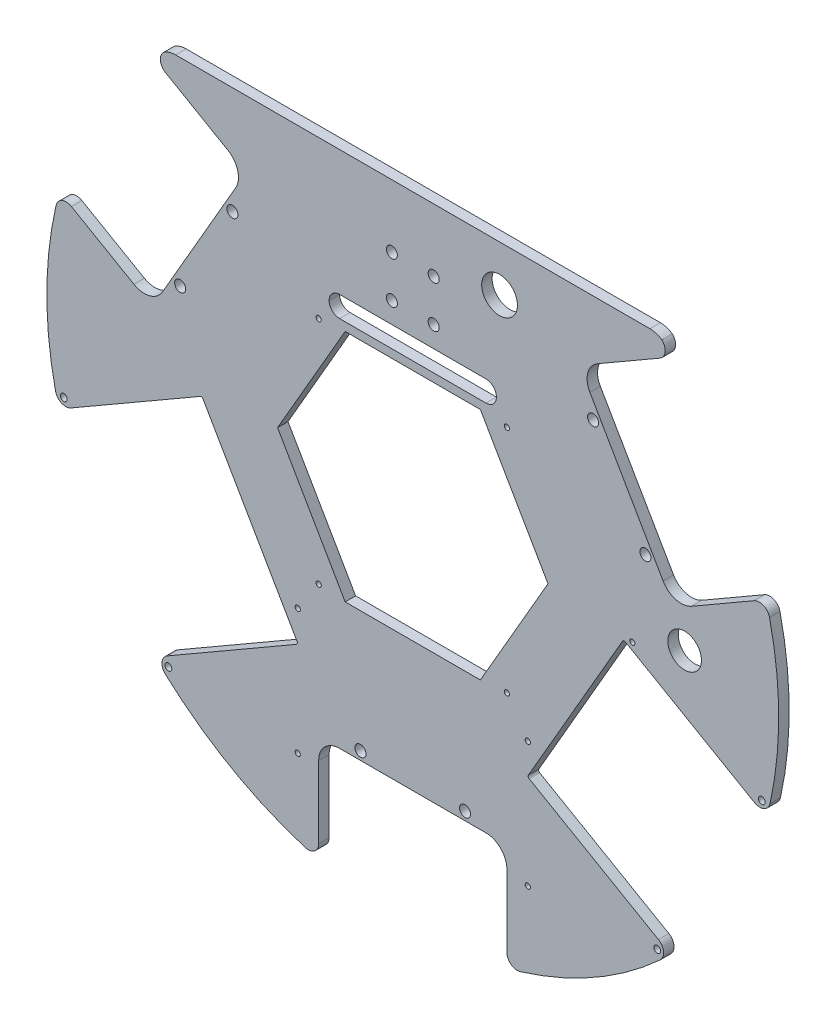
from build123d import *

# Parameters (mm, degrees)
SKETCH_1_R                   = 175
EXTRUDE_1_DEPTH              = 5
CUT_EXTRUDE_1_DEPTH          = 248.53787589
CUT_EXTRUDE_2_DEPTH          = 248.53787589
CUT_EXTRUDE_5_DEPTH          = 248.53787589
CUT_EXTRUDE_4_DEPTH          = 248.53787589
HOLE_WIZARD_M5_1_D           = 5.3
FILLET_1_R                   = 1
FILLET_2_R                   = 10
FILLET_3_R                   = 5
PATTERN_CIRCULAR_1_OUTLINE_R = 2.65
PATTERN_CIRCULAR_1_DEPTH     = 5
HOLE_WIZARD_M5_2_D           = 5.3
SKETCH_15_R                  = 8.55
CUT_EXTRUDE_3_DEPTH          = 243.280431899
MIRROR_1_DEPTH               = 5
SKETCH_18_W                  = 80
SKETCH_18_H                  = 10
CUT_EXTRUDE_6_DEPTH          = 243.280431899
FILLET_4_R                   = 5
M4X0_7_3_D                   = 3.3
SKETCH_33_R                  = 8.05
CUT_EXTRUDE_7_DEPTH          = 243.280431899
M3X0_5_2_D                   = 2.5
M3X0_5_3_D                   = 2.5
FILLET_5_R                   = 10


with BuildPart() as part:
    # 草圖1 → 填料-伸長1 (new body)
    with BuildSketch(Plane.XY):
        Circle(SKETCH_1_R)
    extrude(amount=EXTRUDE_1_DEPTH)

    # 草圖6 → 除料-伸長1 (cut, through all)
    with BuildSketch(Plane.XY.offset(5)):
        with BuildLine():
            Line((-45, -169.115345253), (-45, -118))
            Line((-45, -118), (45, -118))
            Line((45, -118), (45, -169.115345253))
            ThreePointArc((45, -169.115345253), (0, -175), (-45, -169.115345253))
        make_face()
    extrude(amount=-CUT_EXTRUDE_1_DEPTH, mode=Mode.SUBTRACT)

    # 草圖11 → 除料-伸長2 (cut, through all)
    with BuildSketch(Plane.XY.offset(5)):
        Polygon((64.663230149, 0), (32.331615075, 56), (-32.331615075, 56), (-64.663230149, 0), (-32.331615075, -56), (32.331615075, -56), align=None)
    extrude(amount=-CUT_EXTRUDE_2_DEPTH, mode=Mode.SUBTRACT)

    # 草圖17 → 除料-伸長5 (cut, through all)
    with BuildSketch(Plane.XY.offset(5)):
        with BuildLine():
            Line((-169.224997863, -44.585873304), (-100.808990964, -5.085873304))
            Line((-100.808990964, -5.085873304), (-54.808990964, -84.760210452))
            Line((-54.808990964, -84.760210452), (-123.224997863, -124.260210452))
            ThreePointArc((-123.224997863, -124.260210452), (-151.554445662, -87.5), (-169.224997863, -44.585873304))
        make_face()
    extrude(amount=-CUT_EXTRUDE_5_DEPTH, mode=Mode.SUBTRACT)

    # 草圖16 → 除料-伸長4 (cut, through all)
    with BuildSketch(Plane.XY.offset(5)):
        with BuildLine():
            Line((-117.153745139, 130), (117.153745139, 130))
            ThreePointArc((117.153745139, 130), (0, 175), (-117.153745139, 130))
        make_face()
    extrude(amount=-CUT_EXTRUDE_4_DEPTH, mode=Mode.SUBTRACT)

    # M5 餘隙孔1 (through all)
    with Locations(Plane.XY.offset(5)):
        with Locations((25, -114), (-25, -114)):
            Hole(HOLE_WIZARD_M5_1_D / 2)

    # 圓角1
    fillet_1_edges = [part.edges().sort_by_distance(p)[0] for p in [
        (-100.808990964, -5.085873304, 2.5),
        (-54.808990964, -84.760210452, 2.5),
    ]]
    fillet(fillet_1_edges, radius=FILLET_1_R)

    # 圓角2
    fillet_2_edges = [part.edges().sort_by_distance(p)[0] for p in [
        (45, -118, 2.5),
        (-45, -118, 2.5),
    ]]
    fillet(fillet_2_edges, radius=FILLET_2_R)

    # 圓角3
    fillet_3_edges = [part.edges().sort_by_distance(p)[0] for p in [
        (45, -169.115345253, 2.5),
        (-45, -169.115345253, 2.5),
        (-123.224997863, -124.260210452, 2.5),
        (-169.224997863, -44.585873304, 2.5),
    ]]
    fillet(fillet_3_edges, radius=FILLET_3_R)

    # 環狀複製排列1: read off the stored shape, not the designer's step
    # 環狀複製排列1 outline → 環狀複製排列1 (cut)
    with BuildSketch(Plane.XY):
        with BuildLine():
            ThreePointArc((-170.586369053, 39.054970147), (-167.71040421, 42.522591801), (-163.212472795, 42.269240876))
            Line((-163.212472795, 42.269240876), (-133.351251684, 25.02885683))
            ThreePointArc((-133.351251684, 25.02885683), (-125.763061233, 24.029852605), (-119.690997647, 28.689110868))
            Line((-119.690997647, 28.689110868), (-84.690997647, 89.310889132))
            ThreePointArc((-84.690997647, 89.310889132), (-83.691993422, 96.899079583), (-88.351251684, 102.97114317))
            Line((-88.351251684, 102.97114317), (-118.212472795, 120.211527217))
            ThreePointArc((-118.212472795, 120.211527217), (-120.680846839, 123.980174625), (-119.115780818, 128.204644066))
            ThreePointArc((-119.115780818, 128.204644066), (-151.554445662, 87.5), (-170.586369053, 39.054970147))
        make_face()
        with BuildLine():
            ThreePointArc((119.115780818, 128.204644066), (120.680846839, 123.980174625), (118.212472795, 120.211527217))
            Line((118.212472795, 120.211527217), (88.351251684, 102.97114317))
            ThreePointArc((88.351251684, 102.97114317), (83.691993422, 96.899079583), (84.690997647, 89.310889132))
            Line((84.690997647, 89.310889132), (119.690997647, 28.689110868))
            ThreePointArc((119.690997647, 28.689110868), (125.763061233, 24.029852605), (133.351251684, 25.02885683))
            Line((133.351251684, 25.02885683), (163.212472795, 42.269240876))
            ThreePointArc((163.212472795, 42.269240876), (167.71040421, 42.522591801), (170.586369053, 39.054970147))
            ThreePointArc((170.586369053, 39.054970147), (151.554445663, 87.5), (119.115780818, 128.204644066))
        make_face()
        with Locations((86.226896031, 78.650635095)):
            Circle(PATTERN_CIRCULAR_1_OUTLINE_R)
        with Locations((111.226896031, 35.349364905)):
            Circle(PATTERN_CIRCULAR_1_OUTLINE_R)
        with Locations((-111.226896031, 35.349364905)):
            Circle(PATTERN_CIRCULAR_1_OUTLINE_R)
        with Locations((-86.226896031, 78.650635095)):
            Circle(PATTERN_CIRCULAR_1_OUTLINE_R)
    extrude(amount=PATTERN_CIRCULAR_1_DEPTH, mode=Mode.SUBTRACT)

    # M5 餘隙孔2 (through all)
    with Locations(Plane.XY.offset(5)):
        with Locations((10, 100), (-10, 80), (-10, 100), (10, 80)):
            Hole(HOLE_WIZARD_M5_2_D / 2)

    # 草圖15 → 除料-伸長3 (cut, through all)
    with BuildSketch(Plane.XY.offset(5)):
        with Locations((41.5, 108)):
            Circle(SKETCH_15_R)
    extrude(amount=-CUT_EXTRUDE_3_DEPTH, mode=Mode.SUBTRACT)

    # 鏡射1: read off the stored shape, not the designer's step
    # 鏡射1 outline → 鏡射1 (cut)
    with BuildSketch(Plane.XY):
        with BuildLine():
            ThreePointArc((118.323726866, -128.936013823), (151.554445662, -87.5), (170.823726866, -38.003346425))
            ThreePointArc((170.823726866, -38.003346425), (167.955089021, -41.494838656), (163.443048956, -41.247663546))
            Line((163.443048956, -41.247663546), (101.675016368, -5.585873304))
            ThreePointArc((101.675016368, -5.585873304), (100.916197323, -5.485972882), (100.308990964, -5.951898708))
            Line((100.308990964, -5.951898708), (55.308990964, -83.894185049))
            ThreePointArc((55.308990964, -83.894185049), (55.209090541, -84.653004094), (55.675016368, -85.260210452))
            Line((55.675016368, -85.260210452), (117.443048956, -120.922000695))
            ThreePointArc((117.443048956, -120.922000695), (119.913128913, -124.705954459), (118.323726866, -128.936013823))
        make_face()
    extrude(amount=MIRROR_1_DEPTH, mode=Mode.SUBTRACT)

    # 草圖18 → 除料-伸長6 (cut, through all)
    with BuildSketch(Plane.XY.offset(5)):
        with Locations((0, 65)):
            Rectangle(SKETCH_18_W, SKETCH_18_H)
    extrude(amount=-CUT_EXTRUDE_6_DEPTH, mode=Mode.SUBTRACT)

    # 圓角4
    fillet_4_edges = [part.edges().sort_by_distance(p)[0] for p in [
        (40, 70, 2.5),
        (40, 60, 2.5),
        (-40, 60, 2.5),
        (-40, 70, 2.5),
    ]]
    fillet(fillet_4_edges, radius=FILLET_4_R - 0.0001)  # a hair under: the kernel refuses the full size

    # M4x0.7 螺紋孔3 (through all)
    with Locations(Plane.XY.offset(5)):
        with Locations((-116.894870844, -125.224312068), (-166.894870844, -38.621771689)):
            m4x0_7_3 = Hole(M4X0_7_3_D / 2)

    # 鏡射2: M4x0.7 螺紋孔3 across plane
    add(m4x0_7_3.mirror(Plane(origin=(0, 0, 0), x_dir=(0, 0, 1), z_dir=(1, 0, 0))), mode=Mode.SUBTRACT)

    # 草圖33 → 除料-伸長7 (cut, through all)
    with BuildSketch(Plane.XY.offset(5)):
        with Locations((130, 5)):
            Circle(SKETCH_33_R)
    extrude(amount=-CUT_EXTRUDE_7_DEPTH, mode=Mode.SUBTRACT)

    # M3x0.5 螺紋孔2 (through all)
    with Locations(Plane.XY.offset(5)):
        with Locations((55, -130), (55, -70), (-55, -130), (-55, -70)):
            Hole(M3X0_5_2_D / 2)

    # M3x0.5 螺紋孔3 (through all)
    with Locations(Plane.XY.offset(5)):
        with Locations((45, 55), (-45, -55), (-45, 55), (45, -55), (105, -4)):
            Hole(M3X0_5_3_D / 2)

    # 圓角5
    # the kernel refuses this fillet: 10 mm, written as the material it takes off along each edge
    with BuildSketch(Plane(origin=(117.153745139, 130, 14.387351056), x_dir=(-1, 0, 0), z_dir=(0, 0, -1))) as fillet_5_piece_1:
        with BuildLine():
            CenterArc((3.754940423, -10), FILLET_5_R, 90, 34.868690312)
            ThreePointArc((-1.962035679, -1.795355934), (-0.984428411, -0.89395076), (0, 0))
            Line((0, 0), (3.754940423, 0))
        make_face()
    extrude(amount=23.774702113, mode=Mode.SUBTRACT)
    with BuildSketch(Plane(origin=(-117.153745139, 130, 14.387351056), x_dir=(-0.7377488527785091, -0.6750752774498513, 0), z_dir=(0, 0, -1))) as fillet_5_piece_2:
        with BuildLine():
            CenterArc((3.980549786, -9.912355975), FILLET_5_R, 97.591305891, 34.868690312)
            Line((-2.770202989, -2.534867448), (0, 0))
            ThreePointArc((0, 0), (1.329744988, 0.005052135), (2.659489977, 0))
        make_face()
    extrude(amount=23.774702113, mode=Mode.SUBTRACT)


solid = part.part
